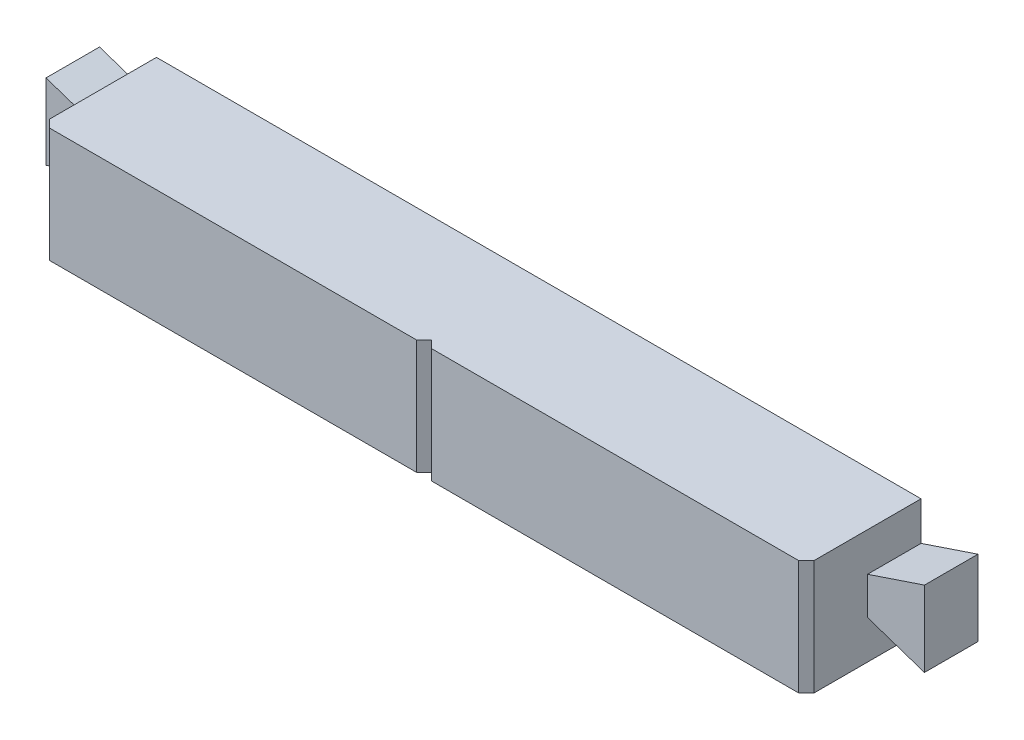
from build123d import *

# Parameters (mm, degrees)
SKETCH1_W              = 100
SKETCH1_H              = 15
BODY_DEPTH             = 15
CLICK_DEPTH            = 7
CLICK_CHAMFER_SIZE     = 1
SKETCH3_R              = 2.5
LED_HOLE_DEPTH         = 8
SKETCH4_W              = 2
SKETCH4_H              = 15
FIELDMARK_DEPTH        = 2
FIELDMARK_CHAMFER_SIZE = 2
LIGHT_START            = -1
SKETCH6_W              = 1
SKETCH6_H              = 15
LIGHT_GUIDE_DEPTH      = 13
SKETCH7_W              = 19
SKETCH7_H              = 1
CUT_EXTRUDE1_DEPTH     = 13.25


with BuildPart() as part:
    # Sketch1 → Body (new body)
    with BuildSketch(Plane.XY):
        Rectangle(SKETCH1_W, SKETCH1_H)
    extrude(amount=BODY_DEPTH)

    # Sketch2 → Click (add)
    with BuildSketch(Plane.XY):
        Polygon((-50, 0), (-50, 2.45), (-57.45, 4.95), (-57.45, 0), (-57.45, -4.95), (-50, -2.45), align=None)
        Polygon((57.45, 0), (57.45, -4.95), (50, -2.45), (50, 0), (50, 2.45), (57.45, 4.95), align=None)
    extrude(amount=CLICK_DEPTH)

    # Click Chamfer
    click_chamfer_edges = [part.edges().sort_by_distance(p)[0] for p in [
        (-50, 0, 15),
        (50, 0, 15),
    ]]
    chamfer(click_chamfer_edges, length=CLICK_CHAMFER_SIZE)

    # Sketch3 → LED Hole (cut)
    with BuildSketch(Plane.XZ.offset(7.5)):
        with Locations(Location((-25, 5.75, 0), (0, 0, 270))):
            Circle(SKETCH3_R)
        with Locations(Location((25, 5.75, 0), (0, 0, 270))):
            Circle(SKETCH3_R)
    extrude(amount=-LED_HOLE_DEPTH, mode=Mode.SUBTRACT)

    # Sketch4 → FieldMark (cut)
    with BuildSketch(Plane.XY.offset(15)):
        Rectangle(SKETCH4_W, SKETCH4_H)
    extrude(amount=-FIELDMARK_DEPTH, mode=Mode.SUBTRACT)

    # FieldMark Chamfer
    # the kernel refuses this chamfer: 2 mm, written as the material it adds along each edge
    with BuildSketch(Plane(origin=(1, -7.5, 13), x_dir=(0.02749587661058638, 0, 0.9996219169112968), z_dir=(0, 1, 0))) as fieldmark_chamfer_piece_1_section:
        Polygon((FIELDMARK_CHAMFER_SIZE * 0.999621916911, -FIELDMARK_CHAMFER_SIZE * 0.0274958766106), (-FIELDMARK_CHAMFER_SIZE * 0.0274958766106, -FIELDMARK_CHAMFER_SIZE * 0.999621916911), (0, 0), align=None)
    fieldmark_chamfer_piece_1 = extrude(amount=15, mode=Mode.PRIVATE)
    fieldmark_chamfer_piece_1 = split(fieldmark_chamfer_piece_1, bisect_by=Plane(origin=(0.339191691, 0, 15), z_dir=(0, 0, -1)), keep=Keep.TOP, mode=Mode.PRIVATE)
    add(fieldmark_chamfer_piece_1)
    with BuildSketch(Plane(origin=(-1, 7.5, 13), x_dir=(0.9996219169112968, 0, -0.027495876610586487), z_dir=(0, -1, 0))) as fieldmark_chamfer_piece_2_section:
        Polygon((FIELDMARK_CHAMFER_SIZE * 0.999621916911, FIELDMARK_CHAMFER_SIZE * 0.0274958766106), (-FIELDMARK_CHAMFER_SIZE * 0.0274958766106, FIELDMARK_CHAMFER_SIZE * 0.999621916911), (0, 0), align=None)
    fieldmark_chamfer_piece_2 = extrude(amount=15, mode=Mode.PRIVATE)
    fieldmark_chamfer_piece_2 = split(fieldmark_chamfer_piece_2, bisect_by=Plane(origin=(-0.339191691, 0, 15), z_dir=(0, 0, -1)), keep=Keep.TOP, mode=Mode.PRIVATE)
    add(fieldmark_chamfer_piece_2)

    # Sketch6 → Light Guide (cut)
    with BuildSketch(Plane.XZ.offset(7.5).offset(LIGHT_START)):
        with Locations((35, 5.75)):
            Rectangle(SKETCH6_W, SKETCH6_H)
        with Locations((15, 5.75)):
            Rectangle(SKETCH6_W, SKETCH6_H)
        with Locations((-15, 5.75)):
            Rectangle(SKETCH6_W, SKETCH6_H)
        with Locations((-35, 5.75)):
            Rectangle(SKETCH6_W, SKETCH6_H)
    extrude(amount=-LIGHT_GUIDE_DEPTH, mode=Mode.SUBTRACT)

    # Sketch7 → Cut-Extrude1 (cut)
    with BuildSketch(Plane(origin=(0, 0, 0), x_dir=(-1, 0, 0), z_dir=(0, 0, -1))):
        with Locations((25, 6)):
            Rectangle(SKETCH7_W, SKETCH7_H)
        with Locations((-25, 6)):
            Rectangle(SKETCH7_W, SKETCH7_H)
    extrude(amount=-CUT_EXTRUDE1_DEPTH, mode=Mode.SUBTRACT)


solid = part.part
